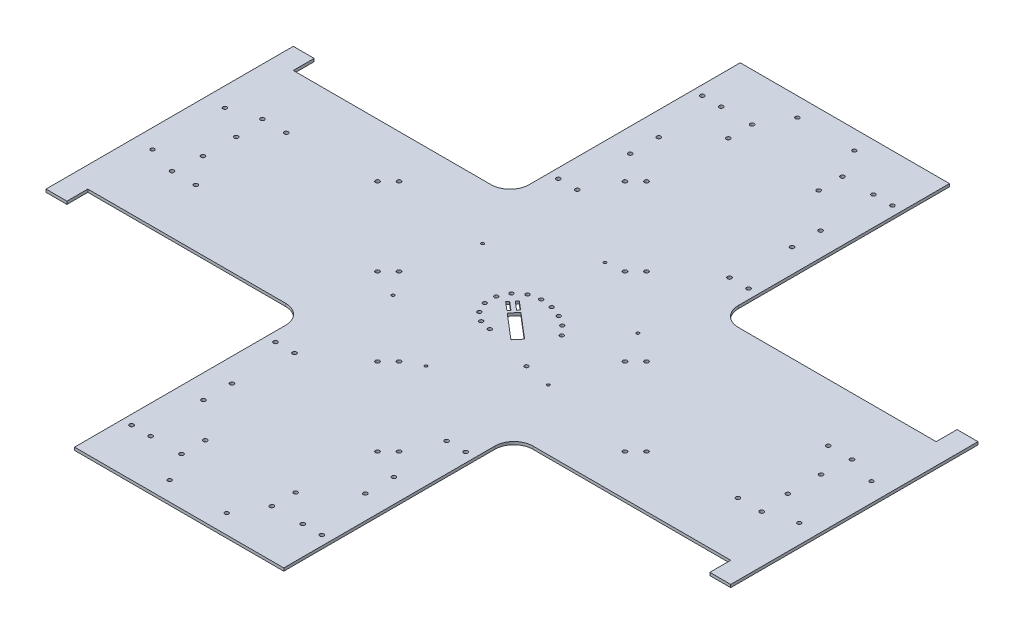
from build123d import *

# Parameters (mm, degrees)
BOSS_EXTRUDE1_DEPTH = 3
SKETCH2_R           = 2.125
CUT_EXTRUDE1_DEPTH  = 503.104570782
SKETCH3_R           = 2
CUT_EXTRUDE2_DEPTH  = 503.104570782
SKETCH4_R           = 2
SKETCH4_R_2         = 1.5
CUT_EXTRUDE3_DEPTH  = 10
SKETCH5_R           = 2.125
CUT_EXTRUDE4_DEPTH  = 10
FILLET1_R           = 20
SKETCH6_R           = 2.125
CUT_EXTRUDE5_DEPTH  = 503.104570782


with BuildPart() as part:
    # Sketch1 → Boss-Extrude1 (new body)
    with BuildSketch(Plane(origin=(0, 0, 0), x_dir=(1, 0, 0), z_dir=(0, 1, 0))):
        Polygon((-110, 350), (-110, 108), (-338, 108), (-338, 130), (-360, 130), (-360, -130), (-338, -130), (-338, -108), (-110, -108), (-110, -350), (110, -350), (110, -108), (338, -108), (338, -130), (360, -130), (360, 130), (338, 130), (338, 108), (110, 108), (110, 350), align=None)
    extrude(amount=BOSS_EXTRUDE1_DEPTH)

    # Sketch2 → Cut-Extrude1 (cut, through all)
    with BuildSketch(Plane(origin=(0, 3, 0), x_dir=(1, 0, 0), z_dir=(0, 1, 0))):
        with Locations((310, 47.5)):
            Circle(SKETCH2_R)
        with Locations((285, 47.5)):
            Circle(SKETCH2_R)
        with Locations((307.5, 17.5)):
            Circle(SKETCH2_R)
        with Locations((307.5, -17.5)):
            Circle(SKETCH2_R)
        with Locations((310, -47.5)):
            Circle(SKETCH2_R)
        with Locations((285, -47.5)):
            Circle(SKETCH2_R)
        with Locations((-285, -47.5)):
            Circle(SKETCH2_R)
        with Locations((-310, -47.5)):
            Circle(SKETCH2_R)
        with Locations((-307.5, -17.5)):
            Circle(SKETCH2_R)
        with Locations((-307.5, 17.5)):
            Circle(SKETCH2_R)
        with Locations((-285, 47.5)):
            Circle(SKETCH2_R)
        with Locations((-310, 47.5)):
            Circle(SKETCH2_R)
        with Locations((47.5, 300)):
            Circle(SKETCH2_R)
        with Locations((47.5, 275)):
            Circle(SKETCH2_R)
        with Locations((-47.5, 275)):
            Circle(SKETCH2_R)
        with Locations((-47.5, 300)):
            Circle(SKETCH2_R)
        with Locations((-47.5, -300)):
            Circle(SKETCH2_R)
        with Locations((-47.5, -275)):
            Circle(SKETCH2_R)
        with Locations((47.5, -275)):
            Circle(SKETCH2_R)
        with Locations((47.5, -300)):
            Circle(SKETCH2_R)
    extrude(amount=-CUT_EXTRUDE1_DEPTH, mode=Mode.SUBTRACT)

    # Sketch3 → Cut-Extrude2 (cut, through all)
    with BuildSketch(Plane(origin=(0, 3, 0), x_dir=(1, 0, 0), z_dir=(0, 1, 0))):
        with Locations((340, 38)):
            Circle(SKETCH3_R)
        with Locations((340, -38)):
            Circle(SKETCH3_R)
        with Locations((-340, -38)):
            Circle(SKETCH3_R)
        with Locations((-340, 38)):
            Circle(SKETCH3_R)
        with Locations((-30, 330)):
            Circle(SKETCH3_R)
        with Locations((30, 330)):
            Circle(SKETCH3_R)
        with Locations((30, -330)):
            Circle(SKETCH3_R)
        with Locations((-30, -330)):
            Circle(SKETCH3_R)
    extrude(amount=-CUT_EXTRUDE2_DEPTH, mode=Mode.SUBTRACT)

    # Sketch4 → Cut-Extrude3 (cut)
    with BuildSketch(Plane(origin=(0, 3, 0), x_dir=(1, 0, 0), z_dir=(0, 1, 0))):
        with Locations((0.808520266, 29.830132062)):
            Circle(SKETCH4_R)
        with Locations((13.346143391, 28.330403085)):
            Circle(SKETCH4_R)
        with Locations((25.203013099, 23.988074058)):
            Circle(SKETCH4_R)
        with Locations((35.760220631, 17.060841581)):
            Circle(SKETCH4_R)
        with Locations((44.463500299, 7.912393424)):
            Circle(SKETCH4_R)
        with Locations((53.928254969, -38.753193613)):
            Circle(SKETCH4_R)
        with Locations((-10.859337922, 27.178870948)):
            Circle(SKETCH4_R)
        with Locations((-20.281408497, 19.688806529)):
            Circle(SKETCH4_R)
        with Locations((-25.512210732, 8.848364338)):
            Circle(SKETCH4_R)
        with Locations((-25.512210732, -3.188100214)):
            Circle(SKETCH4_R)
        with Locations((-20.281408497, -14.028542405)):
            Circle(SKETCH4_R)
        with Locations((-10.859337922, -21.518606823)):
            Circle(SKETCH4_R)
        with Locations((0.881523066, -24.169769245)):
            Circle(SKETCH4_R)
        with Locations((0.808520266, 97.080132062)):
            Circle(SKETCH4_R_2)
        with Locations((82.431414572, 49.955132062)):
            Circle(SKETCH4_R_2)
        with Locations((82.431414572, -44.294867938)):
            Circle(SKETCH4_R_2)
        with Locations((0.808520266, -91.419867938)):
            Circle(SKETCH4_R_2)
        with Locations((-80.814374041, -44.294867938)):
            Circle(SKETCH4_R_2)
        with Locations((-80.814374041, 49.955132062)):
            Circle(SKETCH4_R_2)
        Polygon((-4.591750043, -0.423359002), (21.666877407, -22.800456322), (28.282714875, -15.037036032), (2.024087426, 7.340061288), align=None)
        Polygon((-6.875108951, 1.522475548), (-4.929274402, 3.805834456), (-14.062710037, 11.589172655), (-16.008544586, 9.305813746), align=None)
        Polygon((-2.205106032, 7.002536929), (-0.259271483, 9.285895837), (-9.392707118, 17.069234035), (-11.338541667, 14.785875127), align=None)
    extrude(amount=-CUT_EXTRUDE3_DEPTH, mode=Mode.SUBTRACT)

    # Sketch5 → Cut-Extrude4 (cut)
    with BuildSketch(Plane(origin=(0, 3, 0), x_dir=(1, 0, 0), z_dir=(0, 1, 0))):
        with Locations((80, 300)):
            Circle(SKETCH5_R)
        with Locations((80, 148.73)):
            Circle(SKETCH5_R)
        with Locations((85.11, 239.365)):
            Circle(SKETCH5_R)
        with Locations((85.11, 209.365)):
            Circle(SKETCH5_R)
        with Locations((100, 148.73)):
            Circle(SKETCH5_R)
        with Locations((100, 300)):
            Circle(SKETCH5_R)
        with Locations((-100, 300)):
            Circle(SKETCH5_R)
        with Locations((-100, 148.73)):
            Circle(SKETCH5_R)
        with Locations((-85.11, 209.365)):
            Circle(SKETCH5_R)
        with Locations((-85.11, 239.365)):
            Circle(SKETCH5_R)
        with Locations((-80, 148.73)):
            Circle(SKETCH5_R)
        with Locations((-80, 300)):
            Circle(SKETCH5_R)
        with Locations((-80, -300)):
            Circle(SKETCH5_R)
        with Locations((-80, -148.73)):
            Circle(SKETCH5_R)
        with Locations((-85.11, -239.365)):
            Circle(SKETCH5_R)
        with Locations((-85.11, -209.365)):
            Circle(SKETCH5_R)
        with Locations((-100, -148.73)):
            Circle(SKETCH5_R)
        with Locations((-100, -300)):
            Circle(SKETCH5_R)
        with Locations((100, -300)):
            Circle(SKETCH5_R)
        with Locations((100, -148.73)):
            Circle(SKETCH5_R)
        with Locations((85.11, -209.365)):
            Circle(SKETCH5_R)
        with Locations((85.11, -239.365)):
            Circle(SKETCH5_R)
        with Locations((80, -148.73)):
            Circle(SKETCH5_R)
        with Locations((80, -300)):
            Circle(SKETCH5_R)
    extrude(amount=-CUT_EXTRUDE4_DEPTH, mode=Mode.SUBTRACT)

    # Fillet1
    fillet1_edges = [part.edges().sort_by_distance(p)[0] for p in [
        (110, 1.5, -108),
        (-110, 1.5, -108),
        (-110, 1.5, 108),
        (110, 1.5, 108),
    ]]
    fillet(fillet1_edges, radius=FILLET1_R)

    # Sketch6 → Cut-Extrude5 (cut, through all)
    with BuildSketch(Plane(origin=(0, 3, 0), x_dir=(1, 0, 0), z_dir=(0, 1, 0))):
        with Locations((53.325901808, -194.747258045)):
            Circle(SKETCH6_R)
        with Locations((-192.747258045, 51.325901808)):
            Circle(SKETCH6_R)
        with Locations((-28.69848481, -112.722871427)):
            Circle(SKETCH6_R)
        with Locations((-110.722871427, -30.69848481)):
            Circle(SKETCH6_R)
        with Locations((64.639610307, -183.433549546)):
            Circle(SKETCH6_R)
        with Locations((-17.384776311, -101.409162928)):
            Circle(SKETCH6_R)
        with Locations((-99.409162928, -19.384776311)):
            Circle(SKETCH6_R)
        with Locations((-181.433549546, 62.639610307)):
            Circle(SKETCH6_R)
        with Locations((-62.639610307, 181.433549546)):
            Circle(SKETCH6_R)
        with Locations((19.384776311, 99.409162928)):
            Circle(SKETCH6_R)
        with Locations((101.409162928, 17.384776311)):
            Circle(SKETCH6_R)
        with Locations((183.433549546, -64.639610307)):
            Circle(SKETCH6_R)
        with Locations((30.69848481, 110.722871427)):
            Circle(SKETCH6_R)
        with Locations((112.722871427, 28.69848481)):
            Circle(SKETCH6_R)
        with Locations((-51.325901808, 192.747258045)):
            Circle(SKETCH6_R)
        with Locations((194.747258045, -53.325901808)):
            Circle(SKETCH6_R)
    extrude(amount=-CUT_EXTRUDE5_DEPTH, mode=Mode.SUBTRACT)


solid = part.part
